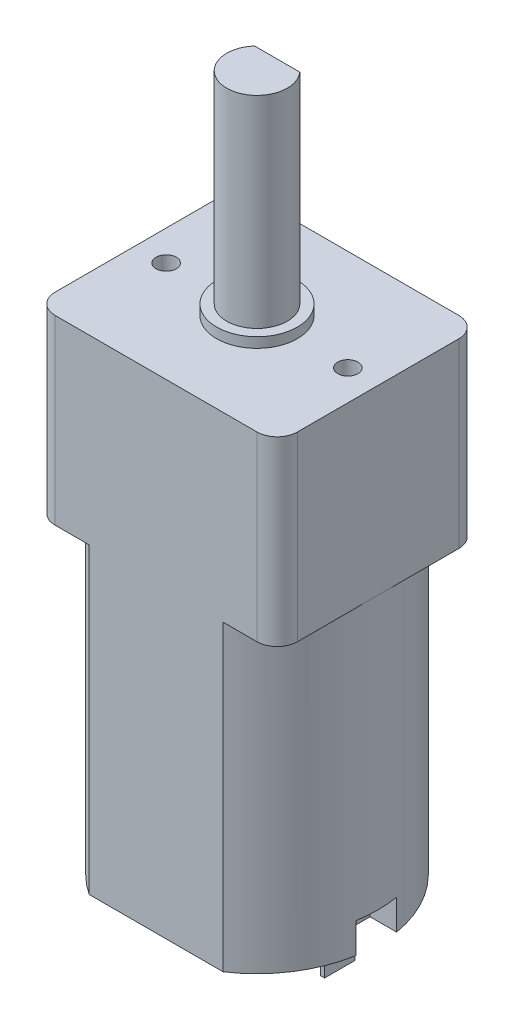
from build123d import *

# Parameters (mm, degrees)
BOSS_EXTRUDE1_DEPTH = 15
SKETCH2_R           = 2.5
BOSS_EXTRUDE2_DEPTH = 1.2
SKETCH3_W           = 0.2
SKETCH3_H           = 1.5
BOSS_EXTRUDE3_DEPTH = 2
SKETCH4_W           = 1.4
SKETCH4_H           = 2
CUT_EXTRUDE1_DEPTH  = 1.5
BOSS_EXTRUDE4_DEPTH = 9
BOSS_EXTRUDE5_DEPTH = 10.5
SKETCH7_R           = 2
BOSS_EXTRUDE6_DEPTH = 0.5
SKETCH8_R           = 0.5
CUT_EXTRUDE2_DEPTH  = 4.5


with BuildPart() as part:
    # Sketch1 → Boss-Extrude1 (new body)
    with BuildSketch(Plane(origin=(0, 0, 0), x_dir=(1, 0, 0), z_dir=(0, 1, 0))):
        with BuildLine():
            Line((-3.31662479, 5), (3.31662479, 5))
            ThreePointArc((3.31662479, 5), (6, 0), (3.31662479, -5))
            Line((3.31662479, -5), (-3.31662479, -5))
            ThreePointArc((-3.31662479, -5), (-6, 0), (-3.31662479, 5))
        make_face()
    extrude(amount=BOSS_EXTRUDE1_DEPTH)

    # Sketch2 → Boss-Extrude2 (add)
    with BuildSketch(Plane.XZ):
        Circle(SKETCH2_R)
    extrude(amount=BOSS_EXTRUDE2_DEPTH)

    # Sketch3 → Boss-Extrude3 (add)
    with BuildSketch(Plane.XZ):
        with Locations((4, 0)):
            Rectangle(SKETCH3_W, SKETCH3_H)
        with Locations((-4, 0)):
            Rectangle(SKETCH3_W, SKETCH3_H)
    extrude(amount=BOSS_EXTRUDE3_DEPTH)

    # Sketch4 → Cut-Extrude1 (cut)
    with BuildSketch(Plane.XZ):
        with Locations((-5.3, 0)):
            Rectangle(SKETCH4_W, SKETCH4_H)
        with Locations((5.3, 0)):
            Rectangle(SKETCH4_W, SKETCH4_H)
    extrude(amount=-CUT_EXTRUDE1_DEPTH, mode=Mode.SUBTRACT)

    # Sketch5 → Boss-Extrude4 (add)
    with BuildSketch(Plane(origin=(0, 15, 0), x_dir=(1, 0, 0), z_dir=(0, 1, 0))):
        with BuildLine():
            Line((-5, 5), (5, 5))
            ThreePointArc((5, 5), (5.707106781, 4.707106781), (6, 4))
            Line((6, 4), (6, -4))
            ThreePointArc((6, -4), (5.707106781, -4.707106781), (5, -5))
            Line((5, -5), (-5, -5))
            ThreePointArc((-5, -5), (-5.707106781, -4.707106781), (-6, -4))
            Line((-6, -4), (-6, 4))
            ThreePointArc((-6, 4), (-5.707106781, 4.707106781), (-5, 5))
        make_face()
    extrude(amount=BOSS_EXTRUDE4_DEPTH)

    # Sketch6 → Boss-Extrude5 (add)
    with BuildSketch(Plane(origin=(0, 24, 0), x_dir=(1, 0, 0), z_dir=(0, 1, 0))):
        with BuildLine():
            Line((-1.118033989, 1), (1.118033989, 1))
            ThreePointArc((1.118033989, 1), (0, -1.5), (-1.118033989, 1))
        make_face()
    extrude(amount=BOSS_EXTRUDE5_DEPTH)

    # Sketch7 → Boss-Extrude6 (add)
    with BuildSketch(Plane(origin=(0, 24, 0), x_dir=(1, 0, 0), z_dir=(0, 1, 0))):
        Circle(SKETCH7_R)
    extrude(amount=BOSS_EXTRUDE6_DEPTH)

    # Sketch8 → Cut-Extrude2 (cut)
    with BuildSketch(Plane(origin=(0, 24, 0), x_dir=(1, 0, 0), z_dir=(0, 1, 0))):
        with Locations((-4.5, 0)):
            Circle(SKETCH8_R)
        with Locations((4.5, 0)):
            Circle(SKETCH8_R)
    extrude(amount=-CUT_EXTRUDE2_DEPTH, mode=Mode.SUBTRACT)


solid = part.part
